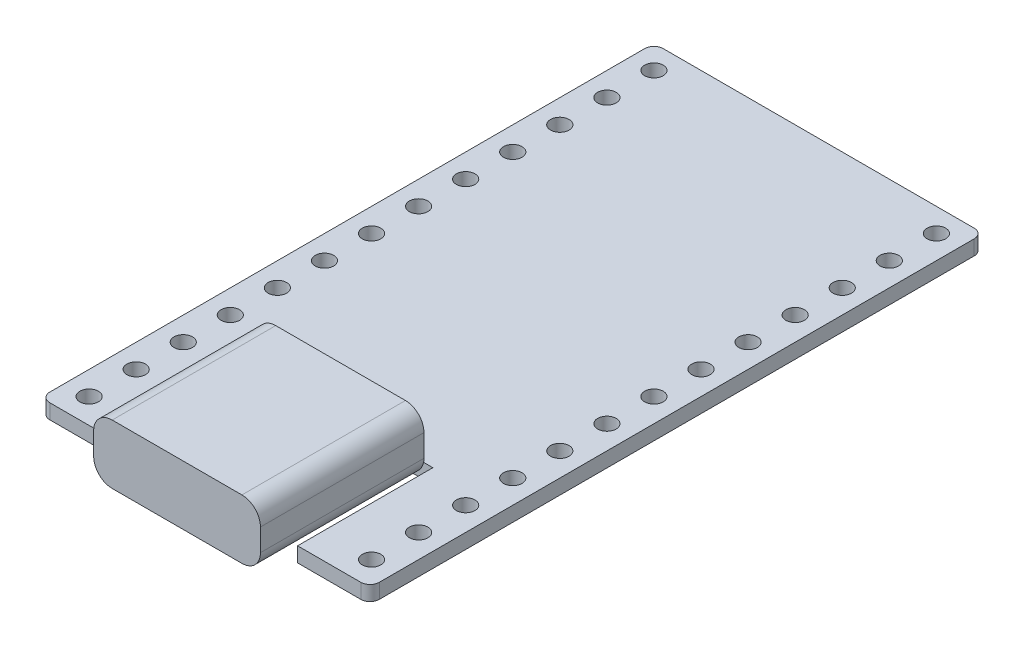
from build123d import *

# Parameters (mm, degrees)
SKETCH1_W           = 17.78
SKETCH1_H           = 33.1
BOSS_EXTRUDE1_DEPTH = 0.8
FILLET1_R           = 0.5
SKETCH2_W           = 9
SKETCH2_H           = 7.3
CUT_EXTRUDE1_DEPTH  = 0.8
SKETCH2_3_W         = 9
SKETCH2_3_H         = 7.3
BOSS_EXTRUDE2_DEPTH = 2.4
SKETCH4_W           = 9
SKETCH4_H           = 2.4
BOSS_EXTRUDE3_DEPTH = 1.524
SKETCH5_W           = 9
SKETCH5_H           = 8.824
BOSS_EXTRUDE4_DEPTH = 0.8
SKETCH6_R           = 0.5
CUT_EXTRUDE2_DEPTH  = 1.524
FILLET2_START       = 8
FILLET2_DEPTH       = 11
FILLET2_START_2     = 16.55
FILLET2_2_DEPTH     = 2.45
CUT_EXTRUDE5_START  = -7.3
CUT_EXTRUDE5_DEPTH  = 7.3


with BuildPart() as part:
    # Sketch1 → Boss-Extrude1 (new body)
    with BuildSketch(Plane(origin=(0, 0, 0), x_dir=(1, 0, 0), z_dir=(0, 1, 0))):
        Rectangle(SKETCH1_W, SKETCH1_H)
    extrude(amount=BOSS_EXTRUDE1_DEPTH)

    # Fillet1
    fillet1_edges = [part.edges().sort_by_distance(p)[0] for p in [
        (-8.89, 0.4, -16.55),
        (8.89, 0.4, -16.55),
        (8.89, 0.4, 16.55),
        (-8.89, 0.4, 16.55),
    ]]
    fillet(fillet1_edges, radius=FILLET1_R)

    # Sketch2 → Cut-Extrude1 (cut)
    with BuildSketch(Plane(origin=(0, 0.8, 0), x_dir=(1, 0, 0), z_dir=(0, 1, 0))):
        with Locations((0, -12.9)):
            Rectangle(SKETCH2_W, SKETCH2_H)
    extrude(amount=-CUT_EXTRUDE1_DEPTH, mode=Mode.SUBTRACT)



with BuildPart() as body_2:
    # Sketch2<3> → Boss-Extrude2 (new body)
    with BuildSketch(Plane(origin=(0, 0.8, 0), x_dir=(1, 0, 0), z_dir=(0, 1, 0))):
        with Locations((0, -12.9)):
            Rectangle(SKETCH2_3_W, SKETCH2_3_H)
    extrude(amount=BOSS_EXTRUDE2_DEPTH)

    # Sketch4 → Boss-Extrude3 (add)
    with BuildSketch(Plane.XY.offset(16.55)):
        with Locations((0, 2)):
            Rectangle(SKETCH4_W, SKETCH4_H)
    extrude(amount=BOSS_EXTRUDE3_DEPTH)


with BuildPart() as part_1:
    add(part.part)

    add(body_2.part)  # Boss-Extrude4 merges body 2
    # Sketch5 → Boss-Extrude4 (add)
    with BuildSketch(Plane.XZ.offset(-0.8)):
        with Locations((0, 13.662)):
            Rectangle(SKETCH5_W, SKETCH5_H)
    extrude(amount=BOSS_EXTRUDE4_DEPTH)

    # Sketch6 → Cut-Extrude2 (cut)
    with BuildSketch(Plane(origin=(0, 0.8, 0), x_dir=(1, 0, 0), z_dir=(0, 1, 0))):
        with Locations(Location((-7.62, 15.28, 0), (0, 0, 270))):
            Circle(SKETCH6_R)
        with Locations(Location((7.62, 15.28, 0), (0, 0, 270))):
            Circle(SKETCH6_R)
        with Locations(Location((7.62, 12.74, 0), (0, 0, 270))):
            Circle(SKETCH6_R)
        with Locations(Location((7.62, 10.2, 0), (0, 0, 270))):
            Circle(SKETCH6_R)
        with Locations(Location((7.62, 7.66, 0), (0, 0, 270))):
            Circle(SKETCH6_R)
        with Locations(Location((7.62, 5.12, 0), (0, 0, 270))):
            Circle(SKETCH6_R)
        with Locations(Location((7.62, 2.58, 0), (0, 0, 270))):
            Circle(SKETCH6_R)
        with Locations(Location((7.62, 0.04, 0), (0, 0, 270))):
            Circle(SKETCH6_R)
        with Locations(Location((7.62, -2.5, 0), (0, 0, 270))):
            Circle(SKETCH6_R)
        with Locations(Location((7.62, -5.04, 0), (0, 0, 270))):
            Circle(SKETCH6_R)
        with Locations(Location((7.62, -7.58, 0), (0, 0, 270))):
            Circle(SKETCH6_R)
        with Locations(Location((7.62, -10.12, 0), (0, 0, 270))):
            Circle(SKETCH6_R)
        with Locations(Location((7.62, -12.66, 0), (0, 0, 270))):
            Circle(SKETCH6_R)
        with Locations(Location((7.62, -15.2, 0), (0, 0, 270))):
            Circle(SKETCH6_R)
        with Locations(Location((-7.62, 12.74, 0), (0, 0, 270))):
            Circle(SKETCH6_R)
        with Locations(Location((-7.62, 10.2, 0), (0, 0, 270))):
            Circle(SKETCH6_R)
        with Locations(Location((-7.62, 7.66, 0), (0, 0, 270))):
            Circle(SKETCH6_R)
        with Locations(Location((-7.62, 5.12, 0), (0, 0, 270))):
            Circle(SKETCH6_R)
        with Locations(Location((-7.62, 2.58, 0), (0, 0, 270))):
            Circle(SKETCH6_R)
        with Locations(Location((-7.62, 0.04, 0), (0, 0, 270))):
            Circle(SKETCH6_R)
        with Locations(Location((-7.62, -2.5, 0), (0, 0, 270))):
            Circle(SKETCH6_R)
        with Locations(Location((-7.62, -5.04, 0), (0, 0, 270))):
            Circle(SKETCH6_R)
        with Locations(Location((-7.62, -7.58, 0), (0, 0, 270))):
            Circle(SKETCH6_R)
        with Locations(Location((-7.62, -10.12, 0), (0, 0, 270))):
            Circle(SKETCH6_R)
        with Locations(Location((-7.62, -12.66, 0), (0, 0, 270))):
            Circle(SKETCH6_R)
        with Locations(Location((-7.62, -15.2, 0), (0, 0, 270))):
            Circle(SKETCH6_R)
    extrude(amount=-CUT_EXTRUDE2_DEPTH, mode=Mode.SUBTRACT)

    # Fillet2: read off the stored shape, not the designer's step
    # Fillet2 outline → Fillet2 (cut)
    with BuildSketch(Plane.XY.offset(FILLET2_START)):
        with BuildLine():
            ThreePointArc((-4.5, 2.2), (-4.207106781, 2.907106781), (-3.5, 3.2))
            Line((-3.5, 3.2), (-4.5, 3.2))
            Line((-4.5, 3.2), (-4.5, 2.2))
        make_face()
        with BuildLine():
            Line((4.5, 3.2), (3.5, 3.2))
            ThreePointArc((3.5, 3.2), (4.207106781, 2.907106781), (4.5, 2.2))
            Line((4.5, 2.2), (4.5, 3.2))
        make_face()
        with BuildLine():
            ThreePointArc((-4.479795897, 0.8), (-4.494936153, 0.899491038), (-4.5, 1))
            Line((-4.5, 1), (-4.5, 0.8))
            Line((-4.5, 0.8), (-4.479795897, 0.8))
        make_face()
        with BuildLine():
            Line((4.5, 0.8), (4.5, 1))
            ThreePointArc((4.5, 1), (4.494936153, 0.899491038), (4.479795897, 0.8))
            Line((4.479795897, 0.8), (4.5, 0.8))
        make_face()
    extrude(amount=FILLET2_DEPTH, mode=Mode.SUBTRACT)

    # Fillet2 2 outline → Fillet2 2 (cut)
    with BuildSketch(Plane.XY.offset(FILLET2_START_2)):
        with BuildLine():
            ThreePointArc((-3.5, 0), (-4.132455532, 0.225403331), (-4.479795897, 0.8))
            Line((-4.479795897, 0.8), (-4.5, 0.8))
            Line((-4.5, 0.8), (-4.5, 0))
            Line((-4.5, 0), (-3.5, 0))
        make_face()
        with BuildLine():
            Line((4.5, 0.8), (4.479795897, 0.8))
            ThreePointArc((4.479795897, 0.8), (4.132455532, 0.225403331), (3.5, 0))
            Line((3.5, 0), (4.5, 0))
            Line((4.5, 0), (4.5, 0.8))
        make_face()
    extrude(amount=FILLET2_2_DEPTH, mode=Mode.SUBTRACT)

    # Sketch7 → Cut-Extrude5 (cut)
    with BuildSketch(Plane.XY.offset(16.55).offset(CUT_EXTRUDE5_START)):
        with BuildLine():
            Line((4.979795897, 0), (4.979795897, 0.8))
            Line((4.979795897, 0.8), (4.479795897, 0.8))
            ThreePointArc((4.479795897, 0.8), (4.132455532, 0.225403331), (3.5, 0))
            Line((3.5, 0), (4.979795897, 0))
        make_face()
        with BuildLine():
            Line((-4.979795897, 0.8), (-4.979795897, 0))
            Line((-4.979795897, 0), (-3.5, 0))
            ThreePointArc((-3.5, 0), (-4.132455532, 0.225403331), (-4.479795897, 0.8))
            Line((-4.479795897, 0.8), (-4.979795897, 0.8))
        make_face()
    extrude(amount=CUT_EXTRUDE5_DEPTH, mode=Mode.SUBTRACT)


solid = part_1.part
